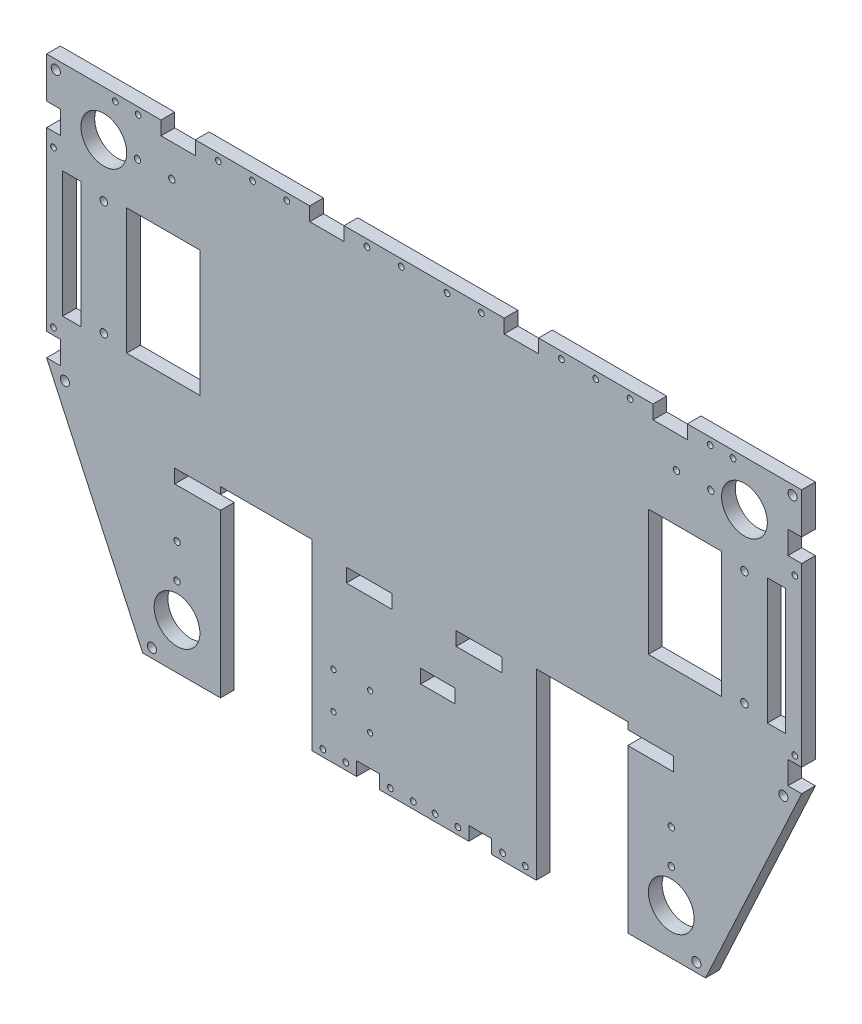
from build123d import *

# Parameters (mm, degrees)
ESQUISSE1_R             = 1.15
ESQUISSE1_W             = 15
ESQUISSE1_H             = 6
BOSS_EXTRU_1_DEPTH      = 6
ESQUISSE2_R             = 10
ESQUISSE2_R_2           = 2
ESQUISSE2_R_3           = 1.4
ESQUISSE2_W             = 8
ESQUISSE2_H             = 55
ESQUISSE2_W_2           = 32
ESQUISSE2_W_3           = 40
ESQUISSE2_H_2           = 80
ENL_V_MAT_EXTRU_1_DEPTH = 6
ESQUISSE3_W             = 6
ESQUISSE3_H             = 10
ESQUISSE3_W_2           = 10
ESQUISSE3_H_2           = 6
ESQUISSE3_W_3           = 15
ENL_V_MAT_EXTRU_2_DEPTH = 6
ESQUISSE4_R             = 1.25
ENL_V_MAT_EXTRU_3_DEPTH = 6
ESQUISSE5_W             = 20
ESQUISSE5_H             = 6
ENL_V_MAT_EXTRU_4_DEPTH = 6
ESQUISSE6_R             = 1.65
ENL_V_MAT_EXTRU_5_DEPTH = 6


with BuildPart() as part:
    # Esquisse1 → Boss.-Extru.1 (new body)
    with BuildSketch(Plane.XY):
        Polygon((-165, 96.73), (165, 96.73), (165, -18.27), (123, -109.022410436), (-123, -109.022410436), (-165, -18.27), align=None)
        with Locations((-23.6, -89.522410436)):
            Circle(ESQUISSE1_R, mode=Mode.SUBTRACT)
        with Locations((-23.6, -73.522410436)):
            Circle(ESQUISSE1_R, mode=Mode.SUBTRACT)
        with Locations((-39.6, -89.522410436)):
            Circle(ESQUISSE1_R, mode=Mode.SUBTRACT)
        with Locations((-39.6, -73.522410436)):
            Circle(ESQUISSE1_R, mode=Mode.SUBTRACT)
        with Locations((6, -57.022410436)):
            Rectangle(ESQUISSE1_W, ESQUISSE1_H, mode=Mode.SUBTRACT)
    extrude(amount=BOSS_EXTRU_1_DEPTH)

    # Esquisse2 → Enlèv. mat.-Extru.1 (cut)
    with BuildSketch(Plane.XY.offset(6)):
        with Locations((140, 76.73)):
            Circle(ESQUISSE2_R)
        with Locations((108, -89.022410436)):
            Circle(ESQUISSE2_R)
        with Locations((-140, 76.73)):
            Circle(ESQUISSE2_R)
        with Locations((-108, -89.022410436)):
            Circle(ESQUISSE2_R)
        with Locations((157, -23.022410436)):
            Circle(ESQUISSE2_R_2)
        with Locations((119, -105.022410436)):
            Circle(ESQUISSE2_R_2)
        with Locations((161, 92.73)):
            Circle(ESQUISSE2_R_2)
        with Locations((-161, 92.73)):
            Circle(ESQUISSE2_R_2)
        with Locations((-157, -23.022410436)):
            Circle(ESQUISSE2_R_2)
        with Locations((-119, -105.022410436)):
            Circle(ESQUISSE2_R_2)
        with Locations((125.27, 76.73)):
            Circle(ESQUISSE2_R_3)
        with Locations((110.27, 76.73)):
            Circle(ESQUISSE2_R_3)
        with Locations((108, -74.292410436)):
            Circle(ESQUISSE2_R_3)
        with Locations((108, -59.292410436)):
            Circle(ESQUISSE2_R_3)
        with Locations((-110.27, 76.73)):
            Circle(ESQUISSE2_R_3)
        with Locations((-125.27, 76.73)):
            Circle(ESQUISSE2_R_3)
        with Locations((-108, -59.292410436)):
            Circle(ESQUISSE2_R_3)
        with Locations((-108, -74.292410436)):
            Circle(ESQUISSE2_R_3)
        with Locations((-154, 28.477589564)):
            Rectangle(ESQUISSE2_W, ESQUISSE2_H)
        with Locations((-114, 28.477589564)):
            Rectangle(ESQUISSE2_W_2, ESQUISSE2_H)
        with Locations((114, 28.477589564)):
            Rectangle(ESQUISSE2_W_2, ESQUISSE2_H)
        with Locations((154, 28.477589564)):
            Rectangle(ESQUISSE2_W, ESQUISSE2_H)
        with Locations((69, -69.022410436)):
            Rectangle(ESQUISSE2_W_3, ESQUISSE2_H_2)
        with Locations((-69, -69.022410436)):
            Rectangle(ESQUISSE2_W_3, ESQUISSE2_H_2)
    extrude(amount=-ENL_V_MAT_EXTRU_1_DEPTH, mode=Mode.SUBTRACT)

    # Esquisse3 → Enlèv. mat.-Extru.2 (cut)
    with BuildSketch(Plane(origin=(0, 0, 0), x_dir=(-1, 0, 0), z_dir=(0, 0, -1))):
        with Locations((162, -13.27)):
            Rectangle(ESQUISSE3_W, ESQUISSE3_H)
        with Locations((162, 73.852589564)):
            Rectangle(ESQUISSE3_W, ESQUISSE3_H)
        with Locations((24.5, -106.022410436)):
            Rectangle(ESQUISSE3_W_2, ESQUISSE3_H_2)
        with Locations((-24.5, -106.022410436)):
            Rectangle(ESQUISSE3_W_2, ESQUISSE3_H_2)
        with Locations((-162, 73.852589564)):
            Rectangle(ESQUISSE3_W, ESQUISSE3_H)
        with Locations((-162, -13.27)):
            Rectangle(ESQUISSE3_W, ESQUISSE3_H)
        with Locations((107.5, 93.73)):
            Rectangle(ESQUISSE3_W_3, ESQUISSE3_H_2)
        with Locations((-42.5, 93.73)):
            Rectangle(ESQUISSE3_W_3, ESQUISSE3_H_2)
        with Locations((42.5, 93.73)):
            Rectangle(ESQUISSE3_W_3, ESQUISSE3_H_2)
        with Locations((-107.5, 93.73)):
            Rectangle(ESQUISSE3_W_3, ESQUISSE3_H_2)
    extrude(amount=-ENL_V_MAT_EXTRU_2_DEPTH, mode=Mode.SUBTRACT)

    # Esquisse4 → Enlèv. mat.-Extru.3 (cut)
    with BuildSketch(Plane(origin=(0, 0, 0), x_dir=(-1, 0, 0), z_dir=(0, 0, -1))):
        with Locations((162, -5.27)):
            Circle(ESQUISSE4_R)
        with Locations((162, 62.852589564)):
            Circle(ESQUISSE4_R)
        with Locations((44.25, -106.022410436)):
            Circle(ESQUISSE4_R)
        with Locations((14.75, -106.022410436)):
            Circle(ESQUISSE4_R)
        with Locations((4.75, -106.022410436)):
            Circle(ESQUISSE4_R)
        with Locations((34.249651607, -106.022410436)):
            Circle(ESQUISSE4_R)
        with Locations((135, 93.73)):
            Circle(ESQUISSE4_R)
        with Locations((125, 93.73)):
            Circle(ESQUISSE4_R)
        with Locations((90, 93.73)):
            Circle(ESQUISSE4_R)
        with Locations((75, 93.73)):
            Circle(ESQUISSE4_R)
        with Locations((60, 93.73)):
            Circle(ESQUISSE4_R)
        with Locations((25, 93.73)):
            Circle(ESQUISSE4_R)
        with Locations((10, 93.73)):
            Circle(ESQUISSE4_R)
        with Locations((-10, 93.73)):
            Circle(ESQUISSE4_R)
        with Locations((-25, 93.73)):
            Circle(ESQUISSE4_R)
        with Locations((-60, 93.73)):
            Circle(ESQUISSE4_R)
        with Locations((-75, 93.73)):
            Circle(ESQUISSE4_R)
        with Locations((-90, 93.73)):
            Circle(ESQUISSE4_R)
        with Locations((-125, 93.73)):
            Circle(ESQUISSE4_R)
        with Locations((-135, 93.73)):
            Circle(ESQUISSE4_R)
        with Locations((-34.249651607, -106.022410436)):
            Circle(ESQUISSE4_R)
        with Locations((-4.75, -106.022410436)):
            Circle(ESQUISSE4_R)
        with Locations((-14.75, -106.022410436)):
            Circle(ESQUISSE4_R)
        with Locations((-44.25, -106.022410436)):
            Circle(ESQUISSE4_R)
        with Locations((-162, 62.852589564)):
            Circle(ESQUISSE4_R)
        with Locations((-162, -5.27)):
            Circle(ESQUISSE4_R)
    extrude(amount=-ENL_V_MAT_EXTRU_3_DEPTH, mode=Mode.SUBTRACT)

    # Esquisse5 → Enlèv. mat.-Extru.4 (cut)
    with BuildSketch(Plane(origin=(0, 0, 0), x_dir=(-1, 0, 0), z_dir=(0, 0, -1))):
        with Locations((99, -35.022410436)):
            Rectangle(ESQUISSE5_W, ESQUISSE5_H)
        with Locations((24, -35.022410436)):
            Rectangle(ESQUISSE5_W, ESQUISSE5_H)
        with Locations((-24, -35.022410436)):
            Rectangle(ESQUISSE5_W, ESQUISSE5_H)
        with Locations((-99, -35.022410436)):
            Rectangle(ESQUISSE5_W, ESQUISSE5_H)
    extrude(amount=-ENL_V_MAT_EXTRU_4_DEPTH, mode=Mode.SUBTRACT)

    # Esquisse6 → Enlèv. mat.-Extru.5 (cut)
    with BuildSketch(Plane(origin=(0, 0, 0), x_dir=(-1, 0, 0), z_dir=(0, 0, -1))):
        with Locations((-140, 3.48)):
            Circle(ESQUISSE6_R)
        with Locations((-140, 53.48)):
            Circle(ESQUISSE6_R)
        with Locations((140, 53.48)):
            Circle(ESQUISSE6_R)
        with Locations((140, 3.48)):
            Circle(ESQUISSE6_R)
    extrude(amount=-ENL_V_MAT_EXTRU_5_DEPTH, mode=Mode.SUBTRACT)


solid = part.part
